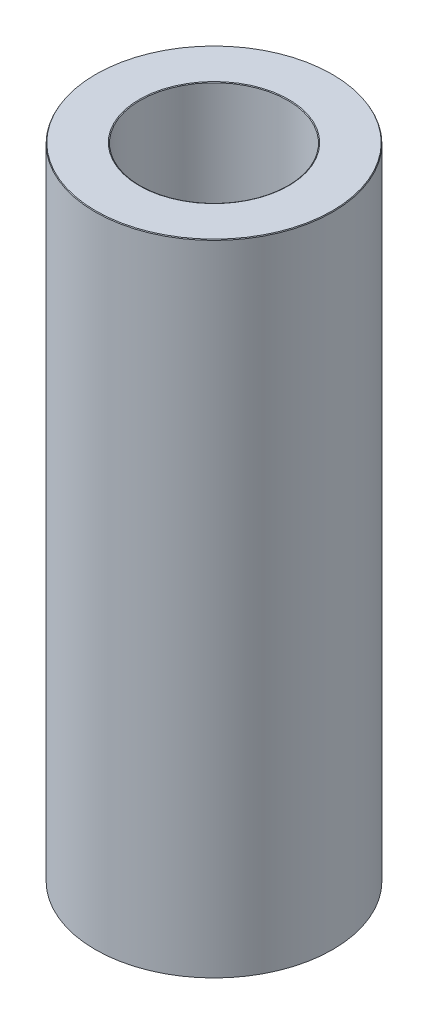
from build123d import *
from OCP.BRepFilletAPI import BRepFilletAPI_MakeChamfer

# Parameters (mm, degrees)
SKETCH1_R           = 40
BOSS_EXTRUDE1_DEPTH = 215.604779691
SKETCH2_R           = 24.909160143
CUT_EXTRUDE1_DEPTH  = 223.902267879
CHAMFER1_SIZE       = 0.273441861
CHAMFER1_SIZE2      = 0.157871732


with BuildPart() as part:
    # Sketch1 → Boss-Extrude1 (new body)
    with BuildSketch(Plane(origin=(0, 0, 0), x_dir=(1, 0, 0), z_dir=(0, 1, 0))):
        Circle(SKETCH1_R)
    extrude(amount=BOSS_EXTRUDE1_DEPTH)

    # Sketch2 → Cut-Extrude1 (cut, through all)
    with BuildSketch(Plane(origin=(0, 0, 0), x_dir=(1, 0, 0), z_dir=(0, 1, 0))):
        Circle(SKETCH2_R)
    extrude(amount=CUT_EXTRUDE1_DEPTH, mode=Mode.SUBTRACT)

    # Chamfer1: one chamfer whose edges measure the first distance from different faces: ONE call of the kernel's chamfer builder (chamfer() names one face for all edges)
    chamfer1_edges_1 = [part.edges().sort_by_distance(p)[0] for p in [
        (-24.909160143, 215.604779691, 0),
    ]]
    chamfer1_side_1 = [part.faces().sort_by_distance(p)[0] for p in [
        (-38.86862915, 215.604779691, 0),
    ]]
    chamfer1_edges_2 = [part.edges().sort_by_distance(p)[0] for p in [
        (-24.909160143, 0, 0),
    ]]
    chamfer1_side_2 = [part.faces().sort_by_distance(p)[0] for p in [
        (-24.909160143, 107.802389845, 0),
    ]]
    chamfer1_edges_3 = [part.edges().sort_by_distance(p)[0] for p in [
        (-40, 0, 0),
    ]]
    chamfer1_side_3 = [part.faces().sort_by_distance(p)[0] for p in [
        (-38.86862915, 0, 0),
    ]]
    chamfer1_edges_4 = [part.edges().sort_by_distance(p)[0] for p in [
        (-40, 215.604779691, 0),
    ]]
    chamfer1_side_4 = [part.faces().sort_by_distance(p)[0] for p in [
        (-40, 107.802389845, 0),
    ]]
    chamfer1 = BRepFilletAPI_MakeChamfer(part.part.solid().wrapped)
    for e in chamfer1_edges_1:
        chamfer1.Add(CHAMFER1_SIZE, CHAMFER1_SIZE2, e.wrapped, chamfer1_side_1[0].wrapped)  # the first distance lies on this face
    for e in chamfer1_edges_2:
        chamfer1.Add(CHAMFER1_SIZE, CHAMFER1_SIZE2, e.wrapped, chamfer1_side_2[0].wrapped)  # the first distance lies on this face
    for e in chamfer1_edges_3:
        chamfer1.Add(CHAMFER1_SIZE, CHAMFER1_SIZE2, e.wrapped, chamfer1_side_3[0].wrapped)  # the first distance lies on this face
    for e in chamfer1_edges_4:
        chamfer1.Add(CHAMFER1_SIZE, CHAMFER1_SIZE2, e.wrapped, chamfer1_side_4[0].wrapped)  # the first distance lies on this face
    add(Compound.cast(chamfer1.Shape()), mode=Mode.REPLACE)


solid = part.part
